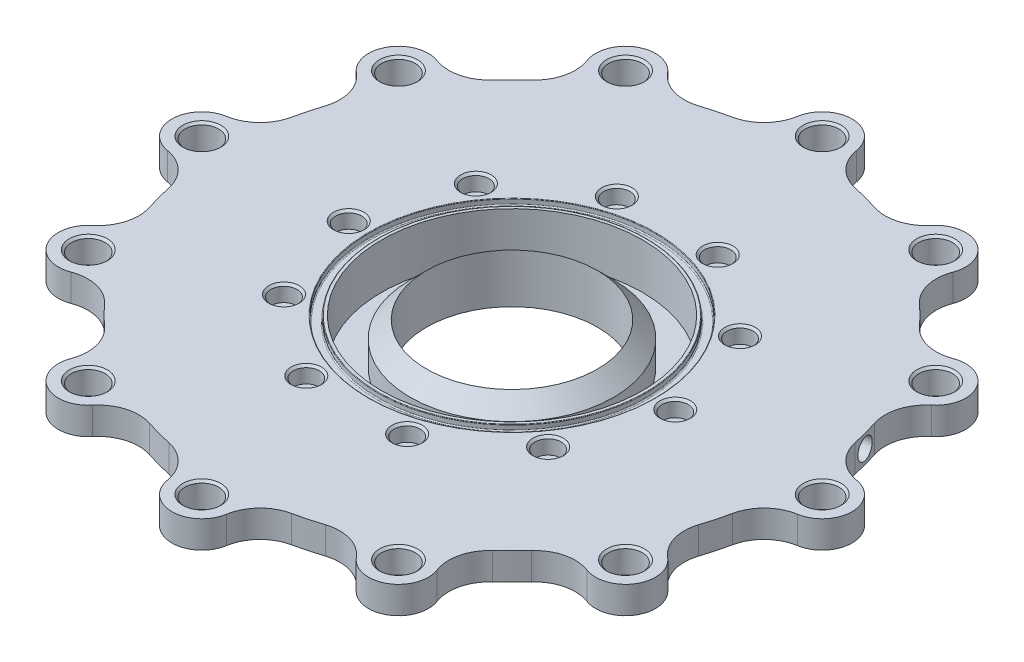
from build123d import *

# Parameters (mm, degrees)
CHAMFER2_SIZE      = 3.81
HOLE3_D            = 6.096
HOLE3_DEPTH        = 3.81
CIRPATTERN1_COUNT  = 10
SKETCH8_W          = 2.1336
SKETCH8_H          = 1.3208
FILLET1_R          = 0.127
FILLET2_R          = 0.254
FILLET3_R          = 0.127
HOLE4_D            = 7.874
CIRPATTERN2_COUNT  = 12
SKETCH33_R         = 3.937
CUT_EXTRUDE1_DEPTH = 114.283003359
CIRPATTERN3_COUNT  = 12
HOLE6_D            = 1.5875
HOLE6_DEPTH        = 11.43
HOLE6_CBORE_D      = 4.7625
HOLE6_CBORE_DEPTH  = 6.35
CHAMFER3_SIZE      = 0.508
CHAMFER4_SIZE      = 0.508


with BuildPart() as part:
    # Sketch1 → Revolve1 (revolve)
    with BuildSketch(Plane.XY, mode=Mode.PRIVATE) as revolve1_sk:
        with BuildLine():
            Line((50.19802, 0), (42.57802, 0))
            ThreePointArc((42.57802, 0), (39.631340216, 0.365254624), (36.86302, 1.43891))
            ThreePointArc((36.86302, 1.43891), (34.094699784, 2.512565376), (31.14802, 2.87782))
            Line((31.14802, 2.87782), (19.939, 2.87782))
            Line((19.939, 2.87782), (19.939, 14.33322))
            Line((19.939, 14.33322), (23.749, 14.33322))
            Line((23.749, 14.33322), (23.749, 4.62026))
            Line((23.749, 4.62026), (30.48, 4.62026))
            Line((30.48, 4.62026), (30.48, 15.24))
            Line((30.48, 15.24), (43.84802, 15.24))
            Line((43.84802, 15.24), (79.375, 15.24))
            Line((79.375, 15.24), (79.375, 8.89))
            Line((79.375, 8.89), (59.72302, 8.89))
            Line((59.72302, 8.89), (59.72302, 10.6045))
            Line((59.72302, 10.6045), (50.19802, 10.6045))
            Line((50.19802, 10.6045), (50.19802, 3.556))
            Line((50.19802, 3.556), (48.92802, 3.556))
            Line((48.92802, 3.556), (48.92802, 1.524))
            Line((48.92802, 1.524), (50.19802, 1.524))
            Line((50.19802, 1.524), (50.19802, 0))
        make_face()
    revolve(revolve1_sk.sketch.rotate(Axis((0, 0, 0), (0, 1, 0)), 90), axis=Axis((0, 0, 0), (0, 1, 0)))

    # Chamfer2
    chamfer2_edges = [part.edges().sort_by_distance(p)[0] for p in [
        (0, 14.33322, 23.749),
    ]]
    chamfer(chamfer2_edges, length=CHAMFER2_SIZE - 0.0001)  # a hair under: the kernel refuses the full size

    # Hole3
    with Locations(Plane(origin=(0, 15.24, 0), x_dir=(1, 0, 0), z_dir=(0, 1, 0))):
        with Locations((38.1, 0)):
            hole3 = Hole(HOLE3_D / 2, depth=HOLE3_DEPTH)

    # Sketch7 → M4x0.7 Tapped Hole1 (revolve, cut)
    with BuildSketch(Plane(origin=(38.1, 11.43, 0), x_dir=(0, 0, 1), z_dir=(1, 0, 0))):
        Polygon((0, 0), (0, 8.103420021), (1.65, 7.112), (1.65, 0), align=None)
    m4x0_7_tapped_hole1 = revolve(axis=Axis((38.1, 17.78, 0), (0, -1, 0)), mode=Mode.SUBTRACT)

    # CirPattern1: Hole3, M4x0.7 Tapped Hole1 ×10 about axis
    cirpattern1_axis = Axis((0, 0, 0), (0, 1, 0))
    add([hole3.rotate(cirpattern1_axis, i * 360 / CIRPATTERN1_COUNT) for i in range(1, CIRPATTERN1_COUNT)], mode=Mode.SUBTRACT)
    add([m4x0_7_tapped_hole1.rotate(cirpattern1_axis, i * 360 / CIRPATTERN1_COUNT) for i in range(1, CIRPATTERN1_COUNT)], mode=Mode.SUBTRACT)

    # Sketch8 → Cut-Revolve1 (revolve, cut)
    with BuildSketch(Plane.XY, mode=Mode.PRIVATE) as cut_revolve1_sk:
        with Locations((32.3215, 14.5796)):
            Rectangle(SKETCH8_W, SKETCH8_H)
    revolve(cut_revolve1_sk.sketch.rotate(Axis((0, 15.24, 0), (0, -1, 0)), 270), axis=Axis((0, 15.24, 0), (0, -1, 0)), mode=Mode.SUBTRACT)

    # Fillet1
    fillet1_edges = [part.edges().sort_by_distance(p)[0] for p in [
        (0, 15.24, 31.2547),
        (0, 15.24, 33.3883),
    ]]
    fillet(fillet1_edges, radius=FILLET1_R)

    # Fillet2
    fillet2_edges = [part.edges().sort_by_distance(p)[0] for p in [
        (0, 13.9192, 33.3883),
        (0, 13.9192, 31.2547),
    ]]
    fillet(fillet2_edges, radius=FILLET2_R)

    # Fillet3
    fillet3_edges = [part.edges().sort_by_distance(p)[0] for p in [
        (0, 1.524, 50.19802),
        (0, 3.556, 50.19802),
    ]]
    fillet(fillet3_edges, radius=FILLET3_R)

    # Hole4 (through all)
    with Locations(Plane(origin=(0, 15.24, 0), x_dir=(1, 0, 0), z_dir=(0, 1, 0))):
        with Locations((0, 72.39)):
            hole4 = Hole(HOLE4_D / 2)

    # CirPattern2: Hole4 ×12 about axis
    cirpattern2_axis = Axis((0, 0, 0), (0, 1, 0))
    for i in range(1, CIRPATTERN2_COUNT):
        add(hole4.rotate(cirpattern2_axis, i * 360 / CIRPATTERN2_COUNT), mode=Mode.SUBTRACT)

    # Sketch33 → Cut-Extrude1 (cut, through all)
    with BuildSketch(Plane(origin=(0, 15.24, 0), x_dir=(1, 0, 0), z_dir=(0, 1, 0))):
        with Locations(Location((72.39, 0, 0), (0, 0, 270))):
            Circle(SKETCH33_R)
        with Locations(Location((62.69157898, 36.195, 0), (0, 0, 270))):
            Circle(SKETCH33_R)
        with BuildLine():
            ThreePointArc((79.375, 0), (77.717548697, 4.517460557), (73.531778846, 6.891049707))
            ThreePointArc((73.531778846, 6.891049707), (68.521982999, 9.388428721), (65.780227273, 14.268770092))
            ThreePointArc((65.780227273, 14.268770092), (65.016467368, 17.421109926), (64.101732931, 20.532996256))
            ThreePointArc((64.101732931, 20.532996256), (64.035992356, 26.130373726), (67.12591332, 30.798065318))
            ThreePointArc((67.12591332, 30.798065318), (69.56410177, 34.946538746), (68.740766425, 39.6875))
            ThreePointArc((68.740766425, 39.6875), (76.670362462, 20.543761705), (79.375, 0))
        make_face()
    cut_extrude1 = extrude(amount=-CUT_EXTRUDE1_DEPTH, mode=Mode.SUBTRACT)

    # CirPattern3: Cut-Extrude1 ×12 about axis
    cirpattern3_axis = Axis((0, 0, 0), (0, 1, 0))
    for i in range(1, CIRPATTERN3_COUNT):
        add(cut_extrude1.rotate(cirpattern3_axis, i * 360 / CIRPATTERN3_COUNT), mode=Mode.SUBTRACT)

    # Hole6
    with Locations(Plane(origin=(65.016467368, 12.065, -17.421109926), x_dir=(0.258819045103, 0, 0.965925826289), z_dir=(0.965925826289, 0, -0.258819045103))):
        with Locations((0, 0)):
            CounterBoreHole(HOLE6_D / 2, HOLE6_CBORE_D / 2, HOLE6_CBORE_DEPTH, depth=HOLE6_DEPTH)

    # Sketch50 → Cut-Revolve2 (revolve, cut)
    with BuildSketch(Plane(origin=(53.975935173, 0, -14.46280824), x_dir=(-0.25881904510252796, 0, -0.9659258262890664), z_dir=(0.9659258262890664, 0, -0.25881904510252796)), mode=Mode.PRIVATE) as cut_revolve2_sk:
        with BuildLine():
            Line((0, 12.85875), (0, 9.303))
            Line((0, 9.303), (3.418146312, 9.303))
            Line((3.418146312, 9.303), (0.79375, 12.065))
            ThreePointArc((0.79375, 12.065), (0.561266008, 12.626266008), (0, 12.85875))
        make_face()
    revolve(cut_revolve2_sk.sketch.rotate(Axis((53.975935173, 12.85875, -14.46280824), (0, -1, 0)), 15), axis=Axis((53.975935173, 12.85875, -14.46280824), (0, -1, 0)), mode=Mode.SUBTRACT)

    # Chamfer3
    chamfer3_edges = [part.edges().sort_by_distance(p)[0] for p in [
        (41.148, 15.24, 0),
        (33.289431285, 15.24, -24.186187561),
        (12.715431285, 15.24, -39.134073533),
        (-12.715431285, 15.24, -39.134073533),
        (-33.289431285, 15.24, -24.186187561),
        (-41.148, 15.24, 0),
        (-33.289431285, 15.24, 24.186187561),
        (-12.715431285, 15.24, 39.134073533),
        (12.715431285, 15.24, 39.134073533),
        (33.289431285, 15.24, 24.186187561),
    ]]
    chamfer(chamfer3_edges, length=CHAMFER3_SIZE)

    # Chamfer4
    chamfer4_edges = [part.edges().sort_by_distance(p)[0] for p in [
        (3.937, 8.89, -72.39),
        (3.937, 15.24, -72.39),
        (39.604542015, 8.89, -60.72307898),
        (39.604542015, 15.24, -60.72307898),
        (64.66007898, 8.89, -32.785457985),
        (64.66007898, 15.24, -32.785457985),
        (72.39, 8.89, 3.937),
        (72.39, 15.24, 3.937),
        (60.72307898, 8.89, 39.604542015),
        (60.72307898, 15.24, 39.604542015),
        (32.785457985, 8.89, 64.66007898),
        (32.785457985, 15.24, 64.66007898),
        (-3.937, 8.89, 72.39),
        (-3.937, 15.24, 72.39),
        (-39.604542015, 8.89, 60.72307898),
        (-39.604542015, 15.24, 60.72307898),
        (-64.66007898, 8.89, 32.785457985),
        (-64.66007898, 15.24, 32.785457985),
        (-72.39, 8.89, -3.937),
        (-72.39, 15.24, -3.937),
        (-60.72307898, 8.89, -39.604542015),
        (-60.72307898, 15.24, -39.604542015),
        (-32.785457985, 8.89, -64.66007898),
        (-32.785457985, 15.24, -64.66007898),
    ]]
    chamfer(chamfer4_edges, length=CHAMFER4_SIZE)


solid = part.part
